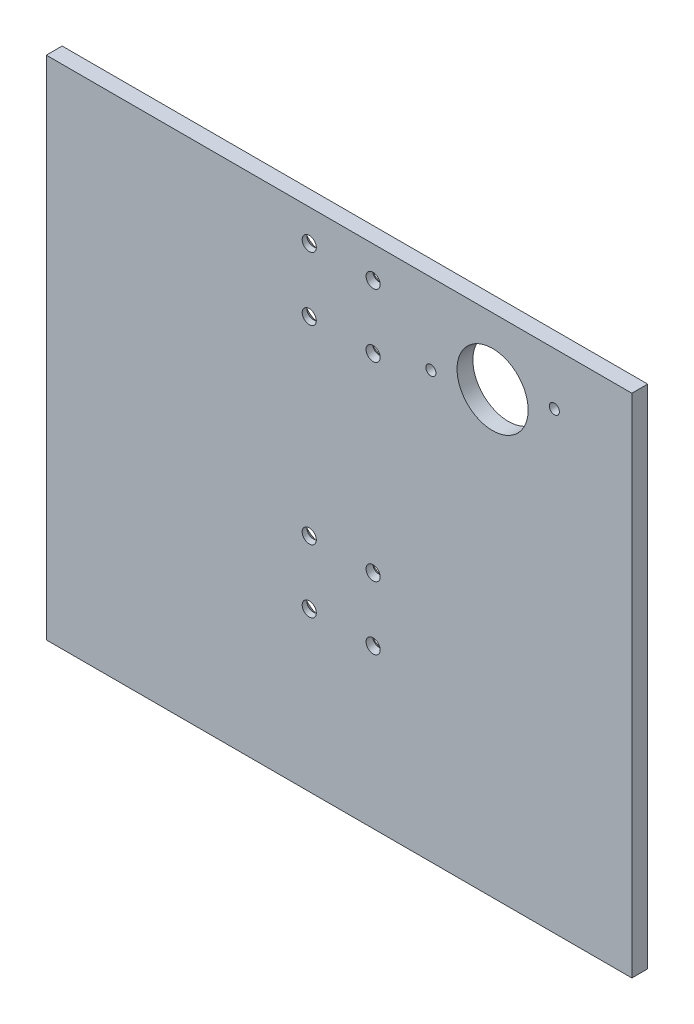
from build123d import *

# Parameters (mm, degrees)
SKETCH1_W                                          = 234.95
SKETCH1_H                                          = 203.2
BOSS_EXTRUDE1_DEPTH                                = 6.35
SKETCH2_R                                          = 14.2748
CUT_EXTRUDE1_DEPTH                                 = 156.445354144
CSK_FOR_10_FLAT_HEAD_MACHINE_SCREW_100_D           = 5.6134
CSK_FOR_10_FLAT_HEAD_MACHINE_SCREW_100_CSINK_D     = 17.78
CSK_FOR_10_FLAT_HEAD_MACHINE_SCREW_100_CSINK_ANGLE = 90
CSK_FOR_10_FLAT_HEAD_MACHINE_SCREW_2_D             = 5.6134
CSK_FOR_10_FLAT_HEAD_MACHINE_SCREW_2_CSINK_D       = 17.78
CSK_FOR_10_FLAT_HEAD_MACHINE_SCREW_2_CSINK_ANGLE   = 90
CUT_EXTRUDE2_DEPTH                                 = 156.445354144


with BuildPart() as part:
    # Sketch1 → Boss-Extrude1 (new body)
    with BuildSketch(Plane.XY):
        Rectangle(SKETCH1_W, SKETCH1_H)
    extrude(amount=BOSS_EXTRUDE1_DEPTH)

    # Sketch2 → Cut-Extrude1 (cut, through all)
    with BuildSketch(Plane.XY.offset(6.35)):
        with Locations((61.595, 74.93)):
            Circle(SKETCH2_R)
    extrude(amount=-CUT_EXTRUDE1_DEPTH, mode=Mode.SUBTRACT)

    # CSK for _10 Flat Head Machine Screw _100 (through all)
    with Locations(Plane(origin=(292.076985897, -265.595089466, -43.80037576), x_dir=(0.9908610866457157, 0, -0.1348862742137668), z_dir=(-0.1348862742137668, 0, -0.9908610866457157))):
        with Locations((-308.041854918, -227.495089466), (-308.041854918, -252.895089466), (-308.041972913, -329.095089466), (-308.041972913, -354.495089466)):
            CounterSinkHole(CSK_FOR_10_FLAT_HEAD_MACHINE_SCREW_100_D / 2, CSK_FOR_10_FLAT_HEAD_MACHINE_SCREW_100_CSINK_D / 2, counter_sink_angle=CSK_FOR_10_FLAT_HEAD_MACHINE_SCREW_100_CSINK_ANGLE)

    # CSK for _10 Flat Head Machine Screw  2 (through all)
    with Locations(Plane(origin=(292.419597033, -265.595089466, -41.283588599), x_dir=(0.9908610866457157, 0, -0.13488627421376656), z_dir=(-0.13488627421376656, 0, -0.9908610866457157))):
        with Locations((-282.641854918, -227.495089466), (-282.641854918, -252.895089466), (-282.641972913, -329.095089466), (-282.641972913, -354.495089466)):
            CounterSinkHole(CSK_FOR_10_FLAT_HEAD_MACHINE_SCREW_2_D / 2, CSK_FOR_10_FLAT_HEAD_MACHINE_SCREW_2_CSINK_D / 2, counter_sink_angle=CSK_FOR_10_FLAT_HEAD_MACHINE_SCREW_2_CSINK_ANGLE)

    # Sketch10 → Cut-Extrude2 (cut, through all)
    with BuildSketch(Plane(origin=(0, 0, 0), x_dir=(-1, 0, 0), z_dir=(0, 0, -1))):
        with BuildLine():
            ThreePointArc((-85.905304985, 82.561948902), (-88.324015931, 81.043732073), (-86.805799102, 78.625021127))
            ThreePointArc((-86.805799102, 78.625021127), (-84.387088156, 80.143237956), (-85.905304985, 82.561948902))
        make_face()
        with BuildLine():
            ThreePointArc((-36.384200898, 71.234978873), (-38.802911844, 69.716762044), (-37.284695015, 67.298051098))
            ThreePointArc((-37.284695015, 67.298051098), (-34.865984069, 68.816267927), (-36.384200898, 71.234978873))
        make_face()
    extrude(amount=-CUT_EXTRUDE2_DEPTH, mode=Mode.SUBTRACT)


solid = part.part
